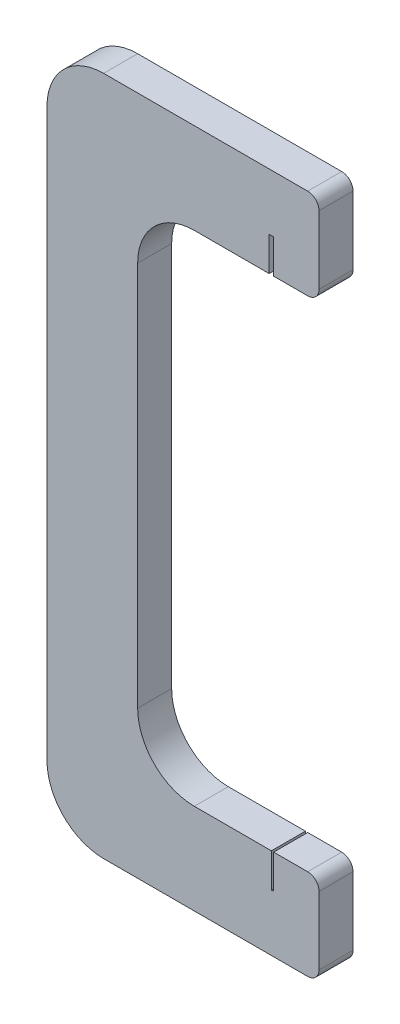
from build123d import *

# Parameters (mm, degrees)
BOSS_EXTRUDE1_DEPTH = 3
SKETCH3_W           = 0.2
SKETCH3_H           = 3
CUT_EXTRUDE1_DEPTH  = 3
SKETCH4_W           = 0.4
SKETCH4_H           = 3
CUT_EXTRUDE2_DEPTH  = 3


with BuildPart() as part:
    # Sketch1 → Boss-Extrude1 (new body)
    with BuildSketch(Plane.XY):
        with BuildLine():
            Line((0, 55), (0, 5))
            ThreePointArc((0, 5), (1.464466094, 1.464466094), (5, 0))
            Line((5, 0), (23, 0))
            ThreePointArc((23, 0), (23.707106781, 0.292893219), (24, 1))
            Line((24, 1), (24, 7))
            ThreePointArc((24, 7), (23.707106781, 7.707106781), (23, 8))
            Line((23, 8), (13, 8))
            ThreePointArc((13, 8), (9.464466094, 9.464466094), (8, 13))
            Line((8, 13), (8, 47))
            ThreePointArc((8, 47), (9.464466094, 50.535533906), (13, 52))
            Line((13, 52), (23, 52))
            ThreePointArc((23, 52), (23.707106781, 52.292893219), (24, 53))
            Line((24, 53), (24, 59))
            ThreePointArc((24, 59), (23.707106781, 59.707106781), (23, 60))
            Line((23, 60), (5, 60))
            ThreePointArc((5, 60), (1.464466094, 58.535533906), (0, 55))
        make_face()
    extrude(amount=BOSS_EXTRUDE1_DEPTH)

    # Sketch3 → Cut-Extrude1 (cut)
    with BuildSketch(Plane(origin=(0, 8, 0), x_dir=(1, 0, 0), z_dir=(0, 1, 0))):
        with Locations((19.9, -1.5)):
            Rectangle(SKETCH3_W, SKETCH3_H)
    extrude(amount=-CUT_EXTRUDE1_DEPTH, mode=Mode.SUBTRACT)

    # Sketch4 → Cut-Extrude2 (cut)
    with BuildSketch(Plane.XZ.offset(-52)):
        with Locations((19.8, 1.5)):
            Rectangle(SKETCH4_W, SKETCH4_H)
    extrude(amount=-CUT_EXTRUDE2_DEPTH, mode=Mode.SUBTRACT)


solid = part.part
